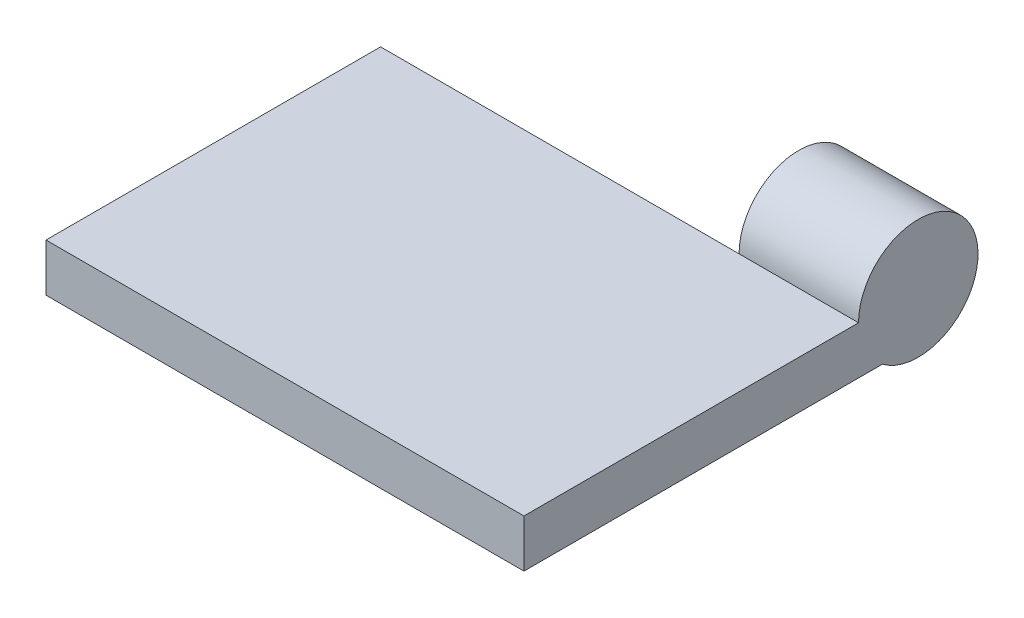
from build123d import *

# Parameters (mm, degrees)
SKETCH2_W           = 20
SKETCH2_H           = 14
BOSS_EXTRUDE2_DEPTH = 2
BOSS_EXTRUDE3_DEPTH = 5


with BuildPart() as part:
    # Sketch2 → Boss-Extrude2 (new body)
    with BuildSketch(Plane(origin=(0, 0, 0), x_dir=(1, 0, 0), z_dir=(0, 1, 0))):
        Rectangle(SKETCH2_W, SKETCH2_H)
    extrude(amount=BOSS_EXTRUDE2_DEPTH)

    # Sketch3 → Boss-Extrude3 (add)
    with BuildSketch(Plane(origin=(10, 0, 0), x_dir=(0, 0, -1), z_dir=(1, 0, 0))):
        with BuildLine():
            Line((7, 2), (7, 0))
            Line((7, 0), (8, 0))
            ThreePointArc((8, 0), (11.736067977, 3.118033989), (7, 2))
        make_face()
    extrude(amount=-BOSS_EXTRUDE3_DEPTH)


solid = part.part
